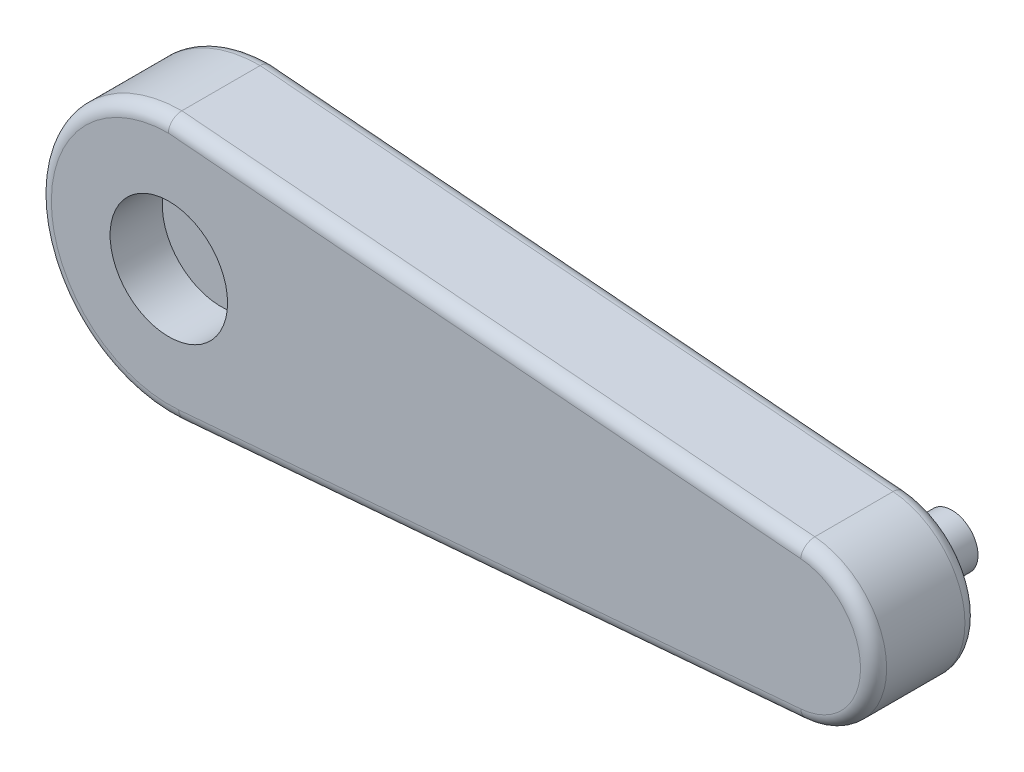
from build123d import *

# Parameters (mm, degrees)
BOSS_EXTRUDE1_DEPTH = 20
SKETCH2_R           = 5
BOSS_EXTRUDE2_DEPTH = 10
SKETCH3_R           = 11.25
CUT_EXTRUDE1_DEPTH  = 10
FILLET1_R           = 2.5
FILLET2_R           = 2.5


with BuildPart() as part:
    # Sketch1 → Boss-Extrude1 (new body)
    with BuildSketch(Plane.XY):
        with BuildLine():
            Line((-49.078947743, 24.658688111), (-53.195876289, 25))
            ThreePointArc((-53.195876289, 25), (-78.174127632, -1.04257365), (-51.112542955, -24.913043215))
            Line((-51.112542955, -24.913043215), (68.054123711, -14.947825929))
            ThreePointArc((68.054123711, -14.947825929), (81.804122753, 0.005360617), (68.04343945, 14.948715547))
            Line((68.04343945, 14.948715547), (-49.078947743, 24.658688111))
        make_face()
    extrude(amount=BOSS_EXTRUDE1_DEPTH)

    # Sketch2 → Boss-Extrude2 (add)
    with BuildSketch(Plane(origin=(0, 0, 0), x_dir=(-1, 0, 0), z_dir=(0, 0, -1))):
        with Locations(Location((-66.804123711, 0, 0), (0, 0, 180))):
            Circle(SKETCH2_R)
    extrude(amount=BOSS_EXTRUDE2_DEPTH)

    # Sketch3 → Cut-Extrude1 (cut)
    with BuildSketch(Plane.XY.offset(20)):
        with Locations((-53.195876289, 0)):
            Circle(SKETCH3_R)
    extrude(amount=-CUT_EXTRUDE1_DEPTH, mode=Mode.SUBTRACT)

    # Fillet1
    # the kernel refuses this fillet: 2.5 mm, written as the material it takes off along each edge
    with BuildSketch(Plane(origin=(66.804123711, 0, 20), x_dir=(0.08333333333333336, -0.9965217285917832, 0), z_dir=(-0.9965217285917832, -0.08333333333333336, 0))) as fillet1_piece_1:
        with BuildLine():
            CenterArc((15 - FILLET1_R, -FILLET1_R), FILLET1_R, 0, 90)
            Line((15 - FILLET1_R, 0), (15 - FILLET1_R, FILLET1_R * 0.02))
            Line((15 - FILLET1_R, FILLET1_R * 0.02), (15 + FILLET1_R * 0.02, FILLET1_R * 0.02))
            Line((15 + FILLET1_R * 0.02, FILLET1_R * 0.02), (15 + FILLET1_R * 0.02, -FILLET1_R))
            Line((15 + FILLET1_R * 0.02, -FILLET1_R), (15, -FILLET1_R))
        make_face()
    revolve(axis=Axis((66.804123711, 0, 20), (0, 0, 1)), revolution_arc=170.480568403, mode=Mode.SUBTRACT)
    with BuildSketch(Plane(origin=(-55.68732888, 25.206552623, 20), x_dir=(-0.08262104926117214, -0.9965810364536258, 0), z_dir=(0.9965810364536258, -0.08262104926117214, 0))) as fillet1_piece_2:
        with BuildLine():
            CenterArc((FILLET1_R, FILLET1_R), FILLET1_R, 180, 90)
            Line((0, FILLET1_R), (-FILLET1_R * 0.02, FILLET1_R))
            Line((-FILLET1_R * 0.02, FILLET1_R), (-FILLET1_R * 0.02, -FILLET1_R * 0.02))
            Line((-FILLET1_R * 0.02, -FILLET1_R * 0.02), (FILLET1_R, -FILLET1_R * 0.02))
            Line((FILLET1_R, -FILLET1_R * 0.02), (FILLET1_R, 0))
        make_face()
    extrude(amount=124.155250606, mode=Mode.SUBTRACT)
    with BuildSketch(Plane(origin=(-53.195876289, 0, 20), x_dir=(0.10000205270336067, 0.994987230800031, 0), z_dir=(0.994987230800031, -0.10000205270336067, 0))) as fillet1_piece_3:
        with BuildLine():
            CenterArc((25 - FILLET1_R, -FILLET1_R), FILLET1_R, 0, 90)
            Line((25 - FILLET1_R, 0), (25 - FILLET1_R, FILLET1_R * 0.02))
            Line((25 - FILLET1_R, FILLET1_R * 0.02), (25 + FILLET1_R * 0.02, FILLET1_R * 0.02))
            Line((25 + FILLET1_R * 0.02, FILLET1_R * 0.02), (25 + FILLET1_R * 0.02, -FILLET1_R))
            Line((25 + FILLET1_R * 0.02, -FILLET1_R), (25, -FILLET1_R))
        make_face()
    revolve(axis=Axis((-53.195876289, 0, 20), (0, 0, 1)), revolution_arc=190.519480528, mode=Mode.SUBTRACT)
    with BuildSketch(Plane(origin=(-51.112542955, -24.913043215, 20), x_dir=(0, 0, -1), z_dir=(0.9965217285917832, 0.08333333333333336, 0))) as fillet1_piece_4:
        with BuildLine():
            CenterArc((FILLET1_R, FILLET1_R), FILLET1_R, 180, 90)
            Line((0, FILLET1_R), (-FILLET1_R * 0.02, FILLET1_R))
            Line((-FILLET1_R * 0.02, FILLET1_R), (-FILLET1_R * 0.02, -FILLET1_R * 0.02))
            Line((-FILLET1_R * 0.02, -FILLET1_R * 0.02), (FILLET1_R, -FILLET1_R * 0.02))
            Line((FILLET1_R, -FILLET1_R * 0.02), (FILLET1_R, 0))
        make_face()
    extrude(amount=119.582607431, mode=Mode.SUBTRACT)

    # Fillet2
    # the kernel refuses this fillet: 2.5 mm, written as the material it takes off along each edge
    with BuildSketch(Plane(origin=(-53.195876289, 0, 0), x_dir=(0.10000205270336067, 0.994987230800031, 0), z_dir=(0.994987230800031, -0.10000205270336067, 0))) as fillet2_piece_1:
        with BuildLine():
            CenterArc((25 - FILLET2_R, FILLET2_R), FILLET2_R, 270, 90)
            Line((25, FILLET2_R), (25 + FILLET2_R * 0.02, FILLET2_R))
            Line((25 + FILLET2_R * 0.02, FILLET2_R), (25 + FILLET2_R * 0.02, -FILLET2_R * 0.02))
            Line((25 + FILLET2_R * 0.02, -FILLET2_R * 0.02), (25 - FILLET2_R, -FILLET2_R * 0.02))
            Line((25 - FILLET2_R, -FILLET2_R * 0.02), (25 - FILLET2_R, 0))
        make_face()
    revolve(axis=Axis((-53.195876289, 0, 0), (0, 0, 1)), revolution_arc=190.519480528, mode=Mode.SUBTRACT)
    with BuildSketch(Plane(origin=(68.04343945, 14.948715547, 0), x_dir=(-0.08262104926117214, -0.9965810364536258, 0), z_dir=(-0.9965810364536258, 0.08262104926117214, 0))) as fillet2_piece_2:
        with BuildLine():
            CenterArc((FILLET2_R, FILLET2_R), FILLET2_R, 180, 90)
            Line((0, FILLET2_R), (-FILLET2_R * 0.02, FILLET2_R))
            Line((-FILLET2_R * 0.02, FILLET2_R), (-FILLET2_R * 0.02, -FILLET2_R * 0.02))
            Line((-FILLET2_R * 0.02, -FILLET2_R * 0.02), (FILLET2_R, -FILLET2_R * 0.02))
            Line((FILLET2_R, -FILLET2_R * 0.02), (FILLET2_R, 0))
        make_face()
    extrude(amount=124.155250606, mode=Mode.SUBTRACT)
    with BuildSketch(Plane(origin=(66.804123711, 0, 0), x_dir=(0.08333333333333336, -0.9965217285917832, 0), z_dir=(-0.9965217285917832, -0.08333333333333336, 0))) as fillet2_piece_3:
        with BuildLine():
            CenterArc((15 - FILLET2_R, FILLET2_R), FILLET2_R, 270, 90)
            Line((15, FILLET2_R), (15 + FILLET2_R * 0.02, FILLET2_R))
            Line((15 + FILLET2_R * 0.02, FILLET2_R), (15 + FILLET2_R * 0.02, -FILLET2_R * 0.02))
            Line((15 + FILLET2_R * 0.02, -FILLET2_R * 0.02), (15 - FILLET2_R, -FILLET2_R * 0.02))
            Line((15 - FILLET2_R, -FILLET2_R * 0.02), (15 - FILLET2_R, 0))
        make_face()
    revolve(axis=Axis((66.804123711, 0, 0), (0, 0, 1)), revolution_arc=170.480568403, mode=Mode.SUBTRACT)
    with BuildSketch(Plane(origin=(-51.112542955, -24.913043215, 0), x_dir=(0, 0, 1), z_dir=(0.9965217285917832, 0.08333333333333336, 0))) as fillet2_piece_4:
        with BuildLine():
            CenterArc((FILLET2_R, -FILLET2_R), FILLET2_R, 90, 90)
            Line((0, -FILLET2_R), (-FILLET2_R * 0.02, -FILLET2_R))
            Line((-FILLET2_R * 0.02, -FILLET2_R), (-FILLET2_R * 0.02, FILLET2_R * 0.02))
            Line((-FILLET2_R * 0.02, FILLET2_R * 0.02), (FILLET2_R, FILLET2_R * 0.02))
            Line((FILLET2_R, FILLET2_R * 0.02), (FILLET2_R, 0))
        make_face()
    extrude(amount=119.582607431, mode=Mode.SUBTRACT)


solid = part.part
